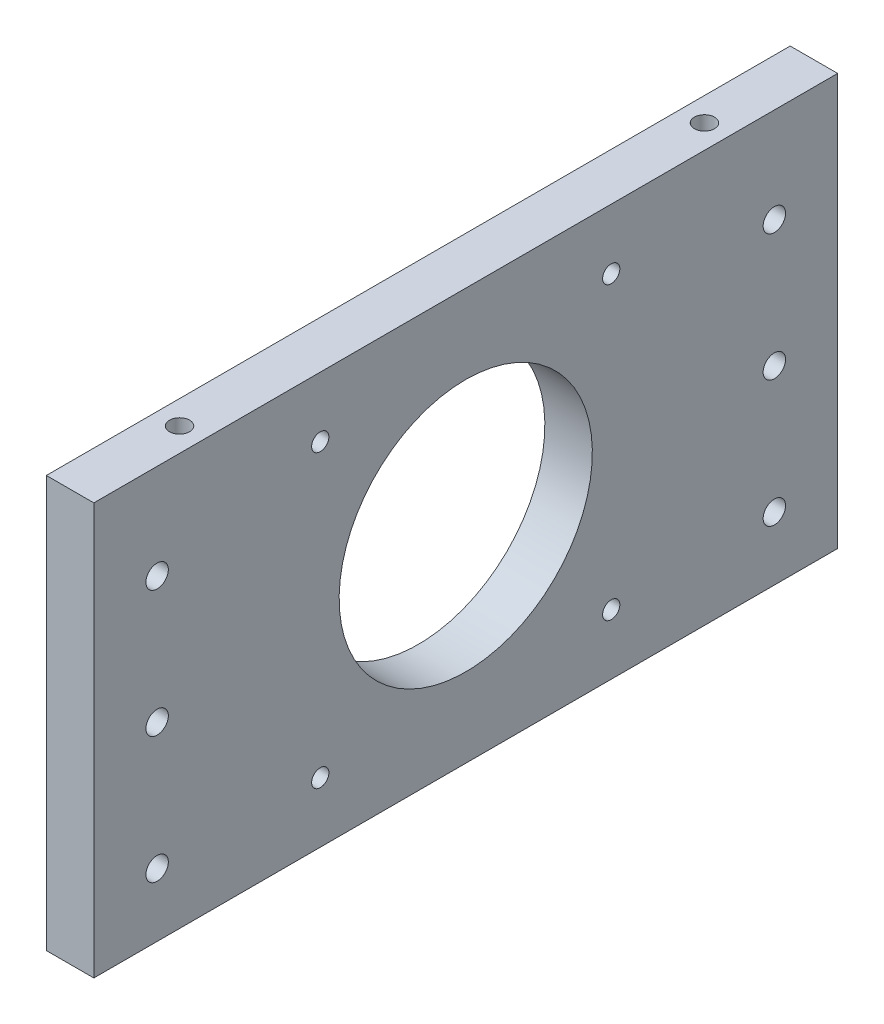
from build123d import *

# Parameters (mm, degrees)
SKETCH1_W                  = 9.525
SKETCH1_H                  = 82.55
BOSS_EXTRUDE1_DEPTH        = 149.225
F_8_32_TAPPED_HOLE5_D      = 3.4544
F_8_CLEARANCE_HOLE2_D      = 4.4958
SKETCH6_R                  = 25.4
CUT_EXTRUDE1_DEPTH         = 156.120765454
CIRPATTERN1_COUNT          = 4
F_10_32_TAPPED_HOLE1_D     = 4.0386
F_10_32_TAPPED_HOLE1_DEPTH = 12.7
F_10_32_TAPPED_HOLE1_TIP   = 1.213317848
F_10_32_TAPPED_HOLE2_D     = 4.0386
F_10_32_TAPPED_HOLE2_DEPTH = 12.7
F_10_32_TAPPED_HOLE2_TIP   = 1.213317848


with BuildPart() as part:
    # Sketch1 → Boss-Extrude1 (new body)
    with BuildSketch(Plane.XY):
        Rectangle(SKETCH1_W, SKETCH1_H)
    extrude(amount=BOSS_EXTRUDE1_DEPTH)

    # #8-32 Tapped Hole5 (through all)
    with Locations(Plane(origin=(4.7625, 0, 0), x_dir=(0, 0, -1), z_dir=(1, 0, 0))):
        with Locations((-45.426667607, 29.185832393)):
            f_8_32_tapped_hole5 = Hole(F_8_32_TAPPED_HOLE5_D / 2)

    # #8 Clearance Hole2 (through all)
    with Locations(Plane(origin=(4.7625, 0, 0), x_dir=(0, 0, -1), z_dir=(1, 0, 0))):
        with Locations((-136.525, 22.225), (-136.525, -3.175), (-136.525, -28.575), (-12.7, 22.225), (-12.7, -3.175), (-12.7, -28.575)):
            Hole(F_8_CLEARANCE_HOLE2_D / 2)

    # Sketch6 → Cut-Extrude1 (cut, through all)
    with BuildSketch(Plane(origin=(4.7625, 0, 0), x_dir=(0, 0, -1), z_dir=(1, 0, 0))):
        with Locations((-74.6125, 0)):
            Circle(SKETCH6_R)
    extrude(amount=-CUT_EXTRUDE1_DEPTH, mode=Mode.SUBTRACT)

    # CirPattern1: #8-32 Tapped Hole5 ×4 about axis
    cirpattern1_axis = Axis((-4.7625, 0, 74.6125), (1, 0, 0))
    for i in range(1, CIRPATTERN1_COUNT):
        add(f_8_32_tapped_hole5.rotate(cirpattern1_axis, i * 360 / CIRPATTERN1_COUNT), mode=Mode.SUBTRACT)

    # #10-32 Tapped Hole1
    with Locations(Plane(origin=(-79.375, 41.275, 74.6125), x_dir=(0, 0, -1), z_dir=(0, 1, 0))):
        with Locations((-52.651418547, 79.375), (-79.375, -52.651418547), (-79.375, 52.651418547), (-52.651418547, -79.375), (52.651418547, -79.375), (79.375, 52.651418547), (79.375, -52.651418547), (52.651418547, 79.375)):
            Hole(F_10_32_TAPPED_HOLE1_D / 2, depth=F_10_32_TAPPED_HOLE1_DEPTH)
            with Locations((0, 0, -(F_10_32_TAPPED_HOLE1_DEPTH + F_10_32_TAPPED_HOLE1_TIP / 2))):  # 118° drill point
                Cone(0, F_10_32_TAPPED_HOLE1_D / 2, F_10_32_TAPPED_HOLE1_TIP, mode=Mode.SUBTRACT)

    # #10-32 Tapped Hole2
    with Locations(Plane(origin=(-79.375, 41.275, 74.6125), x_dir=(0, 0, 1), z_dir=(0, 1, 0))):
        with Locations((-52.651418547, 79.375), (-79.375, -52.651418547), (-79.375, 52.651418547), (-52.651418547, -79.375), (52.651418547, -79.375), (79.375, 52.651418547), (79.375, -52.651418547), (52.651418547, 79.375)):
            Hole(F_10_32_TAPPED_HOLE2_D / 2, depth=F_10_32_TAPPED_HOLE2_DEPTH)
            with Locations((0, 0, -(F_10_32_TAPPED_HOLE2_DEPTH + F_10_32_TAPPED_HOLE2_TIP / 2))):  # 118° drill point
                Cone(0, F_10_32_TAPPED_HOLE2_D / 2, F_10_32_TAPPED_HOLE2_TIP, mode=Mode.SUBTRACT)


solid = part.part
